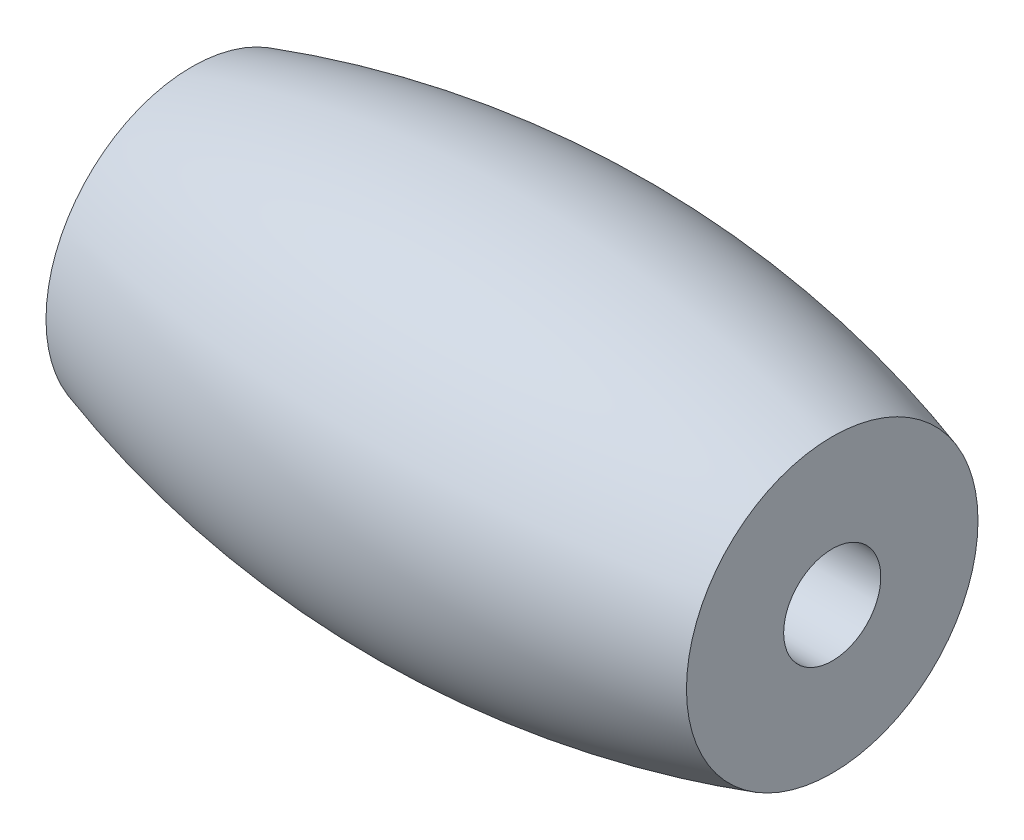
from build123d import *

# Parameters (mm, degrees)
SKETCH2_R          = 2.913907285
CUT_EXTRUDE1_DEPTH = 42.798101401


with BuildPart() as part:
    # Sketch1 → Revolve1 (revolve)
    with BuildSketch(Plane(origin=(0, 0, 0), x_dir=(1, 0, 0), z_dir=(0, 1, 0))):
        with BuildLine():
            Line((-19.205298013, 0), (19.205298013, 0))
            Line((19.205298013, 0), (19.205298013, -8.741721854))
            ThreePointArc((19.205298013, -8.741721854), (0, -11.65562914), (-19.205298013, -8.741721854))
            Line((-19.205298013, -8.741721854), (-19.205298013, 0))
        make_face()
    revolve(axis=Axis((-19.205298013, 0, 0), (1, 0, 0)))

    # Sketch2 → Cut-Extrude1 (cut, through all)
    with BuildSketch(Plane.ZY.offset(19.205298013)):
        Circle(SKETCH2_R)
    extrude(amount=-CUT_EXTRUDE1_DEPTH, mode=Mode.SUBTRACT)


solid = part.part
